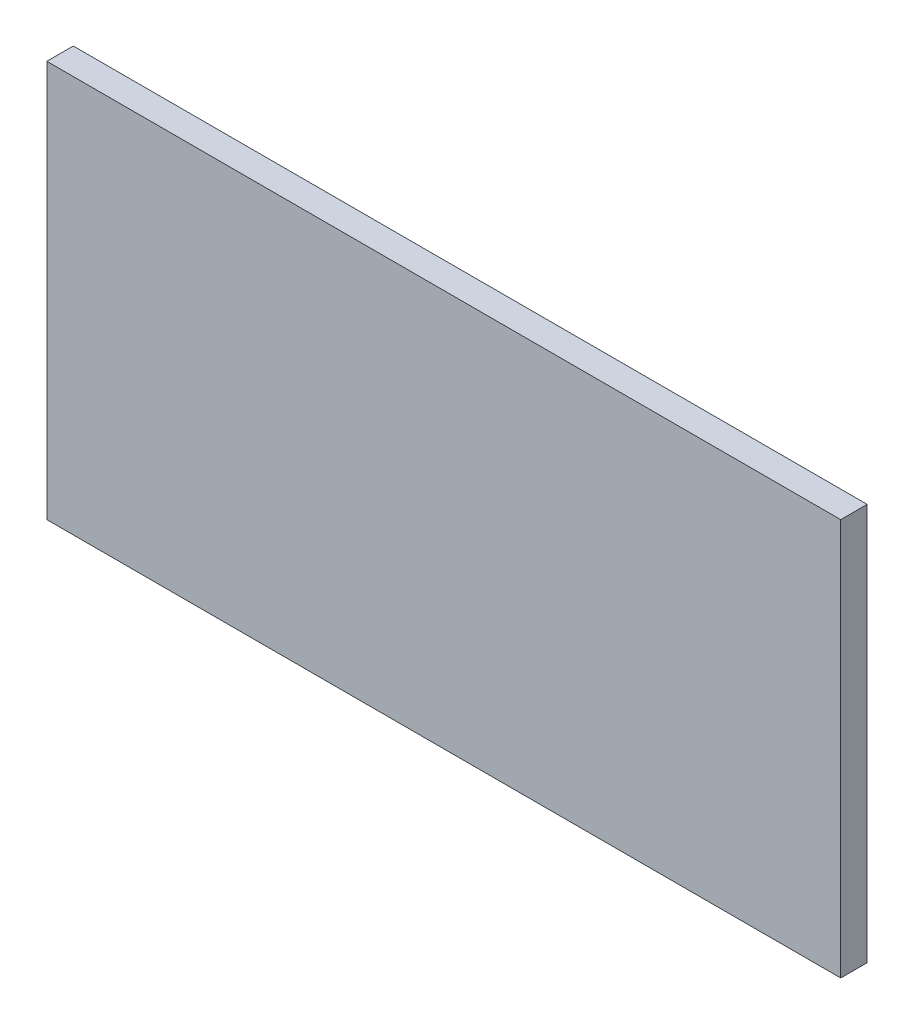
from build123d import *

# Parameters (mm, degrees)
SKETCH4_W           = 1524
SKETCH4_H           = 762
BOSS_EXTRUDE1_DEPTH = 50.8


with BuildPart() as part:
    # Sketch4 → Boss-Extrude1 (new body)
    with BuildSketch(Plane.XY):
        Rectangle(SKETCH4_W, SKETCH4_H)
    extrude(amount=BOSS_EXTRUDE1_DEPTH)


solid = part.part
